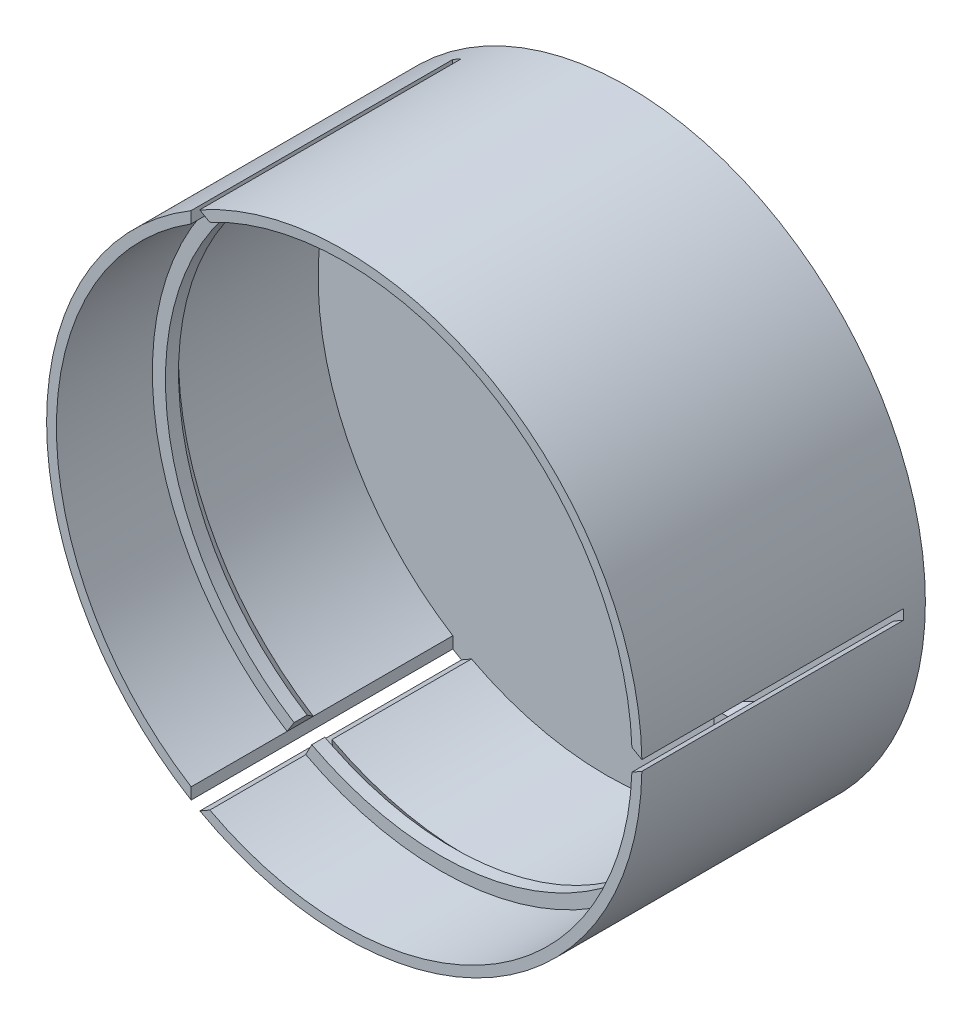
from build123d import *

# Parameters (mm, degrees)
BOSS_EXTRUDE2_DEPTH      = 55
BOSS_EXTRUDE2_DEPTH_BACK = 10
SKETCH1_R                = 68.25
CUT_EXTRUDE1_DEPTH       = 60
BOSS_EXTRUDE3_START      = 3
BOSS_EXTRUDE3_DEPTH      = 3
FILLET1_SIZE             = 3


with BuildPart() as part:
    # Sketch1 → Boss-Extrude2 (new, two sides: drawn at the far end of the back side and taken through both)
    with BuildSketch(Plane.XY.offset(-BOSS_EXTRUDE2_DEPTH_BACK)):
        Circle(SKETCH1_R)
    extrude(amount=BOSS_EXTRUDE2_DEPTH + BOSS_EXTRUDE2_DEPTH_BACK)

    # Sketch3 → Cut-Extrude1 (cut)
    with BuildSketch(Plane.XY.offset(55)):
        with BuildLine():
            Line((-30.84832597, 58.347071776), (-35.132236429, 60.819099042))
            Line((-35.132236429, 60.819099042), (-35.13111961, 55.873110124))
            ThreePointArc((-35.13111961, 55.873110124), (-65.999998317, -0.01490299), (-35.105883409, -55.888969842))
            Line((-35.105883409, -55.888969842), (-35.104766591, -60.83495876))
            Line((-35.104766591, -60.83495876), (-30.821972951, -58.360997108))
            ThreePointArc((-30.821972951, -58.360997108), (33.012905527, -57.150223697), (65.95420938, -2.458101934))
            Line((65.95420938, -2.458101934), (70.23700302, 0.015859718))
            Line((70.23700302, 0.015859718), (65.953092561, 2.487886984))
            ThreePointArc((65.953092561, 2.487886984), (32.98709279, 57.165126688), (-30.84832597, 58.347071776))
        make_face()
    extrude(amount=-CUT_EXTRUDE1_DEPTH, mode=Mode.SUBTRACT)

    # Sketch4 → Boss-Extrude3 (add)
    with BuildSketch(Plane.XY.offset(30).offset(BOSS_EXTRUDE3_START)):
        with BuildLine():
            Line((-35.13111961, 55.873110124), (-33.534250537, 53.3334233))
            ThreePointArc((-33.534250537, 53.3334233), (-62.999998394, -0.014225582), (-33.510161436, -53.348562122))
            Line((-33.510161436, -53.348562122), (-35.105883409, -55.888969842))
            ThreePointArc((-35.105883409, -55.888969842), (-65.999998317, -0.01490299), (-35.13111961, 55.873110124))
        make_face()
        with BuildLine():
            Line((-30.84832597, 58.347071776), (-29.446129335, 55.69493215))
            ThreePointArc((-29.446129335, 55.69493215), (31.438656311, 54.594971283), (62.950857169, 2.487886984))
            Line((62.950857169, 2.487886984), (65.953092561, 2.487886984))
            ThreePointArc((65.953092561, 2.487886984), (32.98709279, 57.165126688), (-30.84832597, 58.347071776))
        make_face()
        with BuildLine():
            Line((65.95420938, -2.458101934), (62.95202725, -2.458101934))
            ThreePointArc((62.95202725, -2.458101934), (31.451571052, -54.587532261), (-29.446129335, -55.69493215))
            Line((-29.446129335, -55.69493215), (-30.84832597, -58.347071776))
            ThreePointArc((-30.84832597, -58.347071776), (33, -57.15767665), (65.95420938, -2.458101934))
        make_face()
    extrude(amount=-BOSS_EXTRUDE3_DEPTH)

    # Fillet1
    fillet1_edges = [part.edges().sort_by_distance(p)[0] for p in [
        (33.012905527, -57.150223697, 30),
        (32.98709279, 57.165126688, 30),
        (-65.999998317, -0.01490299, 30),
    ]]
    chamfer(fillet1_edges, length=FILLET1_SIZE - 0.0001)  # a hair under: the kernel refuses the full size


solid = part.part
